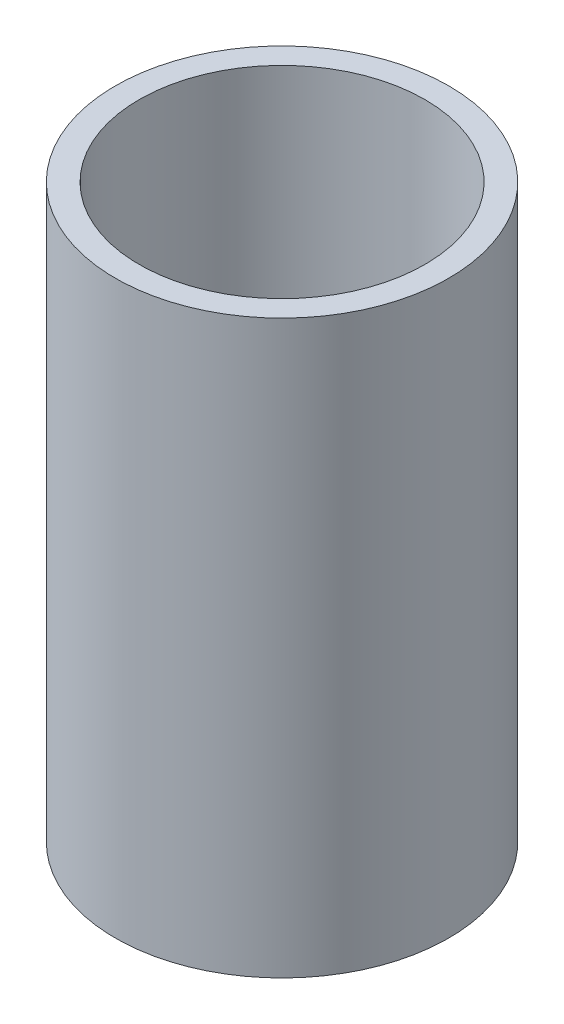
from build123d import *

# Parameters (mm, degrees)
SKETCH1_R           = 22.225
SKETCH1_R_2         = 19.05
BOSS_EXTRUDE1_DEPTH = 76.2


with BuildPart() as part:
    # Sketch1 → Boss-Extrude1 (new body)
    with BuildSketch(Plane(origin=(0, 0, 0), x_dir=(1, 0, 0), z_dir=(0, 1, 0))):
        Circle(SKETCH1_R)
        Circle(SKETCH1_R_2, mode=Mode.SUBTRACT)
    extrude(amount=BOSS_EXTRUDE1_DEPTH)


solid = part.part
